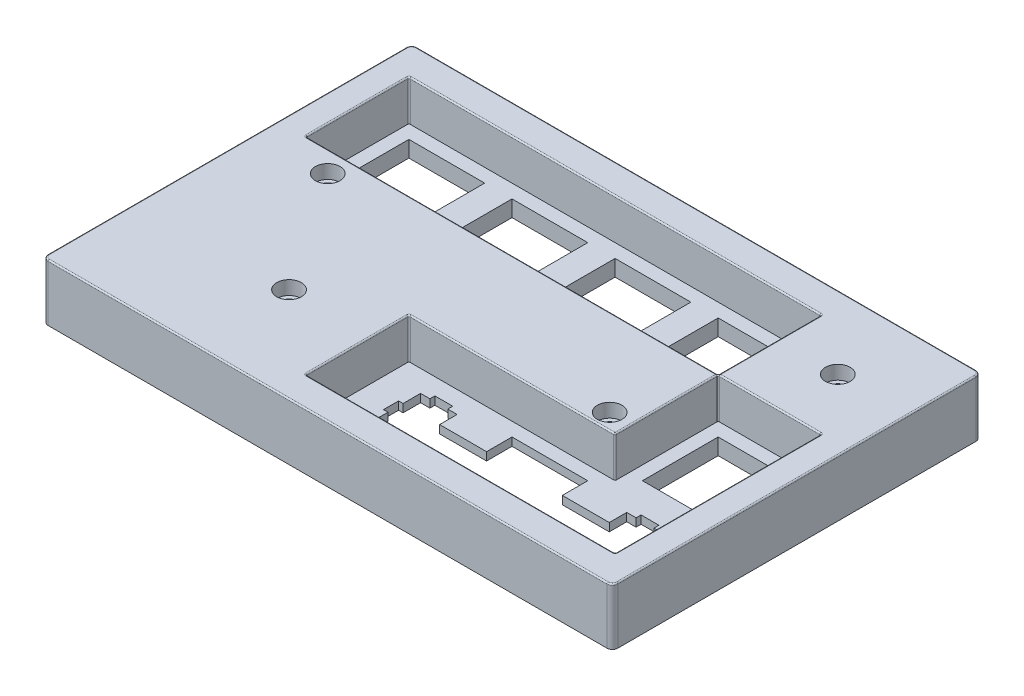
from build123d import *

# Parameters (mm, degrees)
SKETCH5_W           = 105.25
SKETCH5_H           = 68.15
SKETCH5_W_2         = 13.9993
SKETCH5_H_2         = 13.9994
SKETCH5_H_3         = 13.9993
SKETCH5_W_3         = 13.99955
BOSS_EXTRUDE1_DEPTH = 3
SKETCH6_W           = 52.0993
SKETCH6_H           = 19.04996
CUT_EXTRUDE1_DEPTH  = 1.5
SKETCH7_W           = 105.25
SKETCH7_H           = 68.15
SKETCH7_W_2         = 95.24985
SKETCH7_H_2         = 57.14996
BOSS_EXTRUDE2_DEPTH = 7.5
SKETCH9_R           = 1.5
CUT_EXTRUDE3_DEPTH  = 119.670818994
BOSS_EXTRUDE4_START = 7.5
SKETCH10_R          = 1.5
BOSS_EXTRUDE4_DEPTH = 7.5
SKETCH13_R          = 2.275
CUT_EXTRUDE5_DEPTH  = 2.55
FILLET1_R           = 0.25
FILLET2_R           = 1
FILLET3_R           = 0.25


with BuildPart() as part:
    # Sketch5 → Boss-Extrude1 (new body)
    with BuildSketch(Plane(origin=(0, 0, 0), x_dir=(1, 0, 0), z_dir=(0, 1, 0))):
        with Locations((47.7201423, 28.8325965)):
            Rectangle(SKETCH5_W, SKETCH5_H)
        Polygon((82.4438, 7.48273), (82.4438, 3.01377), (84.1692, 3.01377), (84.1692, 2.03261), (87.4695, 2.03261), (87.4695, 3.01377), (89.1949, 3.01377), (89.1949, 9.28384), (90.019, 9.28384), (90.019, 12.0826), (89.1949, 12.0826), (89.1949, 15.3128), (87.4695, 15.3128), (87.4695, 16.2333), (84.1692, 16.2333), (84.1692, 15.3128), (82.4438, 15.3128), (82.4438, 12.0826), (73.769, 12.0826), (73.769, 16.7831), (59.7697, 16.7831), (59.7697, 12.0826), (51.0949, 12.0826), (51.0949, 15.3128), (49.3695, 15.3128), (49.3695, 16.2333), (46.0692, 16.2333), (46.0692, 15.3128), (44.3438, 15.3128), (44.3438, 12.0826), (43.5197, 12.0826), (43.5197, 9.28384), (44.3438, 9.28384), (44.3438, 3.01377), (46.0692, 3.01377), (46.0692, 2.03261), (49.3695, 2.03261), (49.3695, 3.01377), (51.0949, 3.01377), (51.0949, 7.48273), (59.7697, 7.48273), (59.7697, 2.78364), (73.769, 2.78364), (73.769, 7.48273), align=None, mode=Mode.SUBTRACT)
        with Locations((85.81935, 28.8333)):
            Rectangle(SKETCH5_W_2, SKETCH5_H_2, mode=Mode.SUBTRACT)
        with Locations((66.76935, 47.88345)):
            Rectangle(SKETCH5_W_2, SKETCH5_H_3, mode=Mode.SUBTRACT)
        with Locations((47.71935, 47.88345)):
            Rectangle(SKETCH5_W_2, SKETCH5_H_3, mode=Mode.SUBTRACT)
        with Locations((28.66935, 47.88345)):
            Rectangle(SKETCH5_W_2, SKETCH5_H_3, mode=Mode.SUBTRACT)
        with Locations((9.619425, 47.88345)):
            Rectangle(SKETCH5_W_3, SKETCH5_H_3, mode=Mode.SUBTRACT)
    extrude(amount=BOSS_EXTRUDE1_DEPTH)

    # Sketch6 → Cut-Extrude1 (cut)
    with BuildSketch(Plane.XZ):
        with Locations((66.76935, -9.78337)):
            Rectangle(SKETCH6_W, SKETCH6_H)
    extrude(amount=-CUT_EXTRUDE1_DEPTH, mode=Mode.SUBTRACT)

    # Sketch7 → Boss-Extrude2 (add)
    with BuildSketch(Plane(origin=(0, 3, 0), x_dir=(1, 0, 0), z_dir=(0, 1, 0))):
        with Locations((47.7201423, 28.8325965)):
            Rectangle(SKETCH7_W, SKETCH7_H)
        with Locations((47.719325, 28.83337)):
            Rectangle(SKETCH7_W_2, SKETCH7_H_2, mode=Mode.SUBTRACT)
    extrude(amount=BOSS_EXTRUDE2_DEPTH)

    # Sketch9 → Cut-Extrude3 (cut, through all)
    with BuildSketch(Plane(origin=(0, 3, 0), x_dir=(1, 0, 0), z_dir=(0, 1, 0))):
        with Locations(Location((8.094425, 34.40845, 0), (0, 0, 270))):
            Circle(SKETCH9_R)
        with Locations(Location((23.094425, 12.25845, 0), (0, 0, 270))):
            Circle(SKETCH9_R)
        with Locations(Location((87.344425, 49.40845, 0), (0, 0, 270))):
            Circle(SKETCH9_R)
        with Locations(Location((72.344425, 22.25845, 0), (0, 0, 270))):
            Circle(SKETCH9_R)
    extrude(amount=-CUT_EXTRUDE3_DEPTH, mode=Mode.SUBTRACT)

    # Sketch10 → Boss-Extrude4 (add)
    with BuildSketch(Plane(origin=(0, 3, 0), x_dir=(1, 0, 0), z_dir=(0, 1, 0)).offset(BOSS_EXTRUDE4_START)):
        with BuildLine():
            Line((0.0944, 0.25839), (0.0944, 38.35855))
            Line((0.0944, 38.35855), (76.04445, 38.35855))
            ThreePointArc((76.04445, 38.35855), (76.221226695, 38.431773305), (76.29445, 38.60855))
            Line((76.29445, 38.60855), (76.29445, 57.40835))
            Line((76.29445, 57.40835), (95.34425, 57.40835))
            Line((95.34425, 57.40835), (95.34425, 38.35855))
            Line((95.34425, 38.35855), (76.54445, 38.35855))
            ThreePointArc((76.54445, 38.35855), (76.367673305, 38.285326695), (76.29445, 38.10855))
            Line((76.29445, 38.10855), (76.29445, 19.30835))
            Line((76.29445, 19.30835), (38.19435, 19.30835))
            Line((38.19435, 19.30835), (38.19435, 0.25839))
            Line((38.19435, 0.25839), (0.0944, 0.25839))
        make_face()
        with Locations(Location((87.344425, 49.40845, 0), (0, 0, 270))):
            Circle(SKETCH10_R, mode=Mode.SUBTRACT)
        with Locations(Location((72.344425, 22.25845, 0), (0, 0, 270))):
            Circle(SKETCH10_R, mode=Mode.SUBTRACT)
        with Locations(Location((8.094425, 34.40845, 0), (0, 0, 270))):
            Circle(SKETCH10_R, mode=Mode.SUBTRACT)
        with Locations(Location((23.094425, 12.25845, 0), (0, 0, 270))):
            Circle(SKETCH10_R, mode=Mode.SUBTRACT)
    extrude(amount=-BOSS_EXTRUDE4_DEPTH)

    # Sketch13 → Cut-Extrude5 (cut)
    with BuildSketch(Plane(origin=(0, 10.5, 0), x_dir=(1, 0, 0), z_dir=(0, 1, 0))):
        with Locations(Location((8.094425, 34.40845, 0), (0, 0, 270))):
            Circle(SKETCH13_R)
        with Locations(Location((23.094425, 12.25845, 0), (0, 0, 270))):
            Circle(SKETCH13_R)
        with Locations(Location((87.344425, 49.40845, 0), (0, 0, 270))):
            Circle(SKETCH13_R)
        with Locations(Location((72.344425, 22.25845, 0), (0, 0, 270))):
            Circle(SKETCH13_R)
    extrude(amount=-CUT_EXTRUDE5_DEPTH, mode=Mode.SUBTRACT)

    # Fillet1
    fillet1_edges = [part.edges().sort_by_distance(p)[0] for p in [
        (95.34425, 6.75, -0.25839),
        (0.0944, 6.75, -57.40835),
        (76.29445, 6.75, -57.40835),
        (95.34425, 6.75, -38.35855),
        (76.29445, 6.75, -19.30835),
        (38.19435, 6.75, -19.30835),
        (38.19435, 6.75, -0.25839),
        (0.0944, 6.75, -38.35855),
    ]]
    fillet(fillet1_edges, radius=FILLET1_R)

    # Fillet2
    fillet2_edges = [part.edges().sort_by_distance(p)[0] for p in [
        (-4.9048577, 5.25, -62.9075965),
        (100.3451423, 5.25, -62.9075965),
        (100.3451423, 5.25, 5.2424035),
        (-4.9048577, 5.25, 5.2424035),
    ]]
    fillet(fillet2_edges, radius=FILLET2_R)

    # Fillet3
    # the kernel refuses this fillet: 0.25 mm, written as the material it takes off along each edge
    with BuildSketch(Plane(origin=(76.04445, 10.5, -38.60855), x_dir=(0, 0, 1), z_dir=(-1, 0, 0))) as fillet3_piece_1:
        with BuildLine():
            CenterArc((0.25 + FILLET3_R, -FILLET3_R), FILLET3_R, 90, 90)
            Line((0.25, -FILLET3_R), (0.25, 0))
            Line((0.25, 0), (0.25 + FILLET3_R, 0))
        make_face()
    revolve(axis=Axis((76.04445, 10.5, -38.60855), (0, 1, 0)), revolution_arc=90, mode=Mode.SUBTRACT)
    with BuildSketch(Plane(origin=(0.3444, 10.5, -38.35855), x_dir=(0, 0, 1), z_dir=(1, 0, 0))) as fillet3_piece_2:
        with BuildLine():
            CenterArc((FILLET3_R, FILLET3_R), FILLET3_R, 180, 90)
            Line((0, FILLET3_R), (0, 0))
            Line((0, 0), (FILLET3_R, 0))
        make_face()
    extrude(amount=75.70005, mode=Mode.SUBTRACT)
    with BuildSketch(Plane(origin=(76.54445, 10.5, -38.10855), x_dir=(0, 0, -1), z_dir=(1, 0, 0))) as fillet3_piece_3:
        with BuildLine():
            CenterArc((0.25 + FILLET3_R, -FILLET3_R), FILLET3_R, 90, 90)
            Line((0.25, -FILLET3_R), (0.25, 0))
            Line((0.25, 0), (0.25 + FILLET3_R, 0))
        make_face()
    revolve(axis=Axis((76.54445, 10.5, -38.10855), (0, 1, 0)), revolution_arc=90, mode=Mode.SUBTRACT)
    with BuildSketch(Plane(origin=(95.09425, 10.5, -38.35855), x_dir=(0, 0, -1), z_dir=(-1, 0, 0)), Plane(origin=(76.29445, 10.5, -38.60855), x_dir=(1, 0, 0), z_dir=(0, 0, -1))) as fillet3_piece_4:
        with BuildLine():
            CenterArc((FILLET3_R, FILLET3_R), FILLET3_R, 180, 90)
            Line((0, FILLET3_R), (0, 0))
            Line((0, 0), (FILLET3_R, 0))
        make_face()
    extrude(amount=18.5498, mode=Mode.SUBTRACT)
    with BuildSketch(Plane(origin=(95.09425, 10.5, -0.25839), x_dir=(0, 0, 1), z_dir=(-1, 0, 0))) as fillet3_piece_5:
        with BuildLine():
            CenterArc((FILLET3_R, -FILLET3_R), FILLET3_R, 90, 90)
            Line((0, -FILLET3_R), (0, 0))
            Line((0, 0), (FILLET3_R, 0))
        make_face()
    extrude(amount=56.6499, mode=Mode.SUBTRACT)
    with BuildSketch(Plane(origin=(95.34425, 10.5, -38.10855), x_dir=(1, 0, 0), z_dir=(0, 0, 1))) as fillet3_piece_6:
        with BuildLine():
            CenterArc((FILLET3_R, -FILLET3_R), FILLET3_R, 90, 90)
            Line((0, -FILLET3_R), (0, 0))
            Line((0, 0), (FILLET3_R, 0))
        make_face()
    extrude(amount=37.60016, mode=Mode.SUBTRACT)
    with BuildSketch(Plane(origin=(38.19435, 10.5, -19.05835), x_dir=(-1, 0, 0), z_dir=(0, 0, 1))) as fillet3_piece_7:
        with BuildLine():
            CenterArc((FILLET3_R, FILLET3_R), FILLET3_R, 180, 90)
            Line((0, FILLET3_R), (0, 0))
            Line((0, 0), (FILLET3_R, 0))
        make_face()
    extrude(amount=18.54996, mode=Mode.SUBTRACT)
    with BuildSketch(Plane(origin=(76.04445, 10.5, -19.30835), x_dir=(0, 0, -1), z_dir=(-1, 0, 0))) as fillet3_piece_8:
        with BuildLine():
            CenterArc((FILLET3_R, FILLET3_R), FILLET3_R, 180, 90)
            Line((0, FILLET3_R), (0, 0))
            Line((0, 0), (FILLET3_R, 0))
        make_face()
    extrude(amount=37.6001, mode=Mode.SUBTRACT)
    with BuildSketch(Plane(origin=(76.29445, 10.5, -38.10855), x_dir=(-1, 0, 0), z_dir=(0, 0, 1))) as fillet3_piece_9:
        with BuildLine():
            CenterArc((FILLET3_R, FILLET3_R), FILLET3_R, 180, 90)
            Line((0, FILLET3_R), (0, 0))
            Line((0, 0), (FILLET3_R, 0))
        make_face()
    extrude(amount=18.5502, mode=Mode.SUBTRACT)
    with BuildSketch(Plane(origin=(0.0944, 10.5, -38.60855), x_dir=(-1, 0, 0), z_dir=(0, 0, -1))) as fillet3_piece_10:
        with BuildLine():
            CenterArc((FILLET3_R, -FILLET3_R), FILLET3_R, 90, 90)
            Line((0, -FILLET3_R), (0, 0))
            Line((0, 0), (FILLET3_R, 0))
        make_face()
    extrude(amount=18.5498, mode=Mode.SUBTRACT)
    with BuildSketch(Plane(origin=(0.3444, 10.5, -57.40835), x_dir=(0, 0, -1), z_dir=(1, 0, 0))) as fillet3_piece_11:
        with BuildLine():
            CenterArc((FILLET3_R, -FILLET3_R), FILLET3_R, 90, 90)
            Line((0, -FILLET3_R), (0, 0))
            Line((0, 0), (FILLET3_R, 0))
        make_face()
    extrude(amount=75.70005, mode=Mode.SUBTRACT)
    with BuildSketch(Plane(origin=(76.04445, 10.5, -19.55835), x_dir=(1, 0, 0), z_dir=(0, 0, -1))) as fillet3_piece_12:
        with BuildLine():
            CenterArc((0.25 - FILLET3_R, FILLET3_R), FILLET3_R, 270, 90)
            Line((0.25, FILLET3_R), (0.25, 0))
            Line((0.25, 0), (0.25 - FILLET3_R, 0))
        make_face()
    revolve(axis=Axis((76.04445, 10.5, -19.55835), (0, -1, 0)), revolution_arc=90, mode=Mode.SUBTRACT)
    with BuildSketch(Plane(origin=(95.09425, 10.5, -0.50839), x_dir=(1, 0, 0), z_dir=(0, 0, -1))) as fillet3_piece_13:
        with BuildLine():
            CenterArc((0.25 + FILLET3_R, FILLET3_R), FILLET3_R, 180, 90)
            Line((0.25, FILLET3_R), (0.25, 0))
            Line((0.25, 0), (0.25 + FILLET3_R, 0))
        make_face()
    revolve(axis=Axis((95.09425, 10.5, -0.50839), (0, -1, 0)), revolution_arc=90, mode=Mode.SUBTRACT)
    with BuildSketch(Plane(origin=(38.44435, 10.5, -0.50839), x_dir=(0, 0, 1), z_dir=(1, 0, 0))) as fillet3_piece_14:
        with BuildLine():
            CenterArc((0.25 + FILLET3_R, FILLET3_R), FILLET3_R, 180, 90)
            Line((0.25, FILLET3_R), (0.25, 0))
            Line((0.25, 0), (0.25 + FILLET3_R, 0))
        make_face()
    revolve(axis=Axis((38.44435, 10.5, -0.50839), (0, -1, 0)), revolution_arc=90, mode=Mode.SUBTRACT)
    with BuildSketch(Plane(origin=(38.44435, 10.5, -19.05835), x_dir=(-1, 0, 0), z_dir=(0, 0, 1))) as fillet3_piece_15:
        with BuildLine():
            CenterArc((0.25 + FILLET3_R, FILLET3_R), FILLET3_R, 180, 90)
            Line((0.25, FILLET3_R), (0.25, 0))
            Line((0.25, 0), (0.25 + FILLET3_R, 0))
        make_face()
    revolve(axis=Axis((38.44435, 10.5, -19.05835), (0, -1, 0)), revolution_arc=90, mode=Mode.SUBTRACT)
    with BuildSketch(Plane(origin=(95.09425, 10.5, -38.10855), x_dir=(1, 0, 0), z_dir=(0, 0, 1))) as fillet3_piece_16:
        with BuildLine():
            CenterArc((0.25 + FILLET3_R, -FILLET3_R), FILLET3_R, 90, 90)
            Line((0.25, -FILLET3_R), (0.25, 0))
            Line((0.25, 0), (0.25 + FILLET3_R, 0))
        make_face()
    revolve(axis=Axis((95.09425, 10.5, -38.10855), (0, 1, 0)), revolution_arc=90, mode=Mode.SUBTRACT)
    with BuildSketch(Plane(origin=(76.04445, 10.5, -57.15835), x_dir=(0, 0, -1), z_dir=(-1, 0, 0))) as fillet3_piece_17:
        with BuildLine():
            CenterArc((0.25 + FILLET3_R, FILLET3_R), FILLET3_R, 180, 90)
            Line((0.25, FILLET3_R), (0.25, 0))
            Line((0.25, 0), (0.25 + FILLET3_R, 0))
        make_face()
    revolve(axis=Axis((76.04445, 10.5, -57.15835), (0, -1, 0)), revolution_arc=90, mode=Mode.SUBTRACT)
    with BuildSketch(Plane(origin=(0.3444, 10.5, -38.60855), x_dir=(-1, 0, 0), z_dir=(0, 0, -1))) as fillet3_piece_18:
        with BuildLine():
            CenterArc((0.25 + FILLET3_R, -FILLET3_R), FILLET3_R, 90, 90)
            Line((0.25, -FILLET3_R), (0.25, 0))
            Line((0.25, 0), (0.25 + FILLET3_R, 0))
        make_face()
    revolve(axis=Axis((0.3444, 10.5, -38.60855), (0, 1, 0)), revolution_arc=90, mode=Mode.SUBTRACT)
    with BuildSketch(Plane(origin=(0.3444, 10.5, -57.15835), x_dir=(0, 0, -1), z_dir=(1, 0, 0))) as fillet3_piece_19:
        with BuildLine():
            CenterArc((0.25 + FILLET3_R, -FILLET3_R), FILLET3_R, 90, 90)
            Line((0.25, -FILLET3_R), (0.25, 0))
            Line((0.25, 0), (0.25 + FILLET3_R, 0))
        make_face()
    revolve(axis=Axis((0.3444, 10.5, -57.15835), (0, 1, 0)), revolution_arc=90, mode=Mode.SUBTRACT)
    with BuildSketch(Plane(origin=(99.3451423, 10.5, -62.9075965), x_dir=(0, 0, 1), z_dir=(-1, 0, 0)), Plane(origin=(-3.9048577, 10.5, 5.2424035), x_dir=(0, 0, -1), z_dir=(1, 0, 0))) as fillet3_piece_20:
        with BuildLine():
            CenterArc((FILLET3_R, -FILLET3_R), FILLET3_R, 90, 90)
            Line((0, -FILLET3_R), (0, 0))
            Line((0, 0), (FILLET3_R, 0))
        make_face()
    extrude(amount=103.25, mode=Mode.SUBTRACT)
    with BuildSketch(Plane(origin=(100.3451423, 10.5, 4.2424035), x_dir=(-1, 0, 0), z_dir=(0, 0, -1)), Plane(origin=(-4.9048577, 10.5, -61.9075965), x_dir=(1, 0, 0), z_dir=(0, 0, 1))) as fillet3_piece_21:
        with BuildLine():
            CenterArc((FILLET3_R, -FILLET3_R), FILLET3_R, 90, 90)
            Line((0, -FILLET3_R), (0, 0))
            Line((0, 0), (FILLET3_R, 0))
        make_face()
    extrude(amount=66.15, mode=Mode.SUBTRACT)
    with BuildSketch(Plane(origin=(-3.9048577, 10.5, -61.9075965), x_dir=(0, 0, -1), z_dir=(1, 0, 0))) as fillet3_piece_22:
        with BuildLine():
            CenterArc((1 - FILLET3_R, -FILLET3_R), FILLET3_R, 0, 90)
            Line((1, -FILLET3_R), (1, 0))
            Line((1, 0), (1 - FILLET3_R, 0))
        make_face()
    revolve(axis=Axis((-3.9048577, 10.5, -61.9075965), (0, 1, 0)), revolution_arc=90, mode=Mode.SUBTRACT)
    with BuildSketch(Plane(origin=(-3.9048577, 10.5, 4.2424035), x_dir=(0, 0, 1), z_dir=(1, 0, 0))) as fillet3_piece_23:
        with BuildLine():
            CenterArc((1 - FILLET3_R, FILLET3_R), FILLET3_R, 270, 90)
            Line((1, FILLET3_R), (1, 0))
            Line((1, 0), (1 - FILLET3_R, 0))
        make_face()
    revolve(axis=Axis((-3.9048577, 10.5, 4.2424035), (0, -1, 0)), revolution_arc=90, mode=Mode.SUBTRACT)
    with BuildSketch(Plane(origin=(99.3451423, 10.5, 4.2424035), x_dir=(1, 0, 0), z_dir=(0, 0, -1))) as fillet3_piece_24:
        with BuildLine():
            CenterArc((1 - FILLET3_R, FILLET3_R), FILLET3_R, 270, 90)
            Line((1, FILLET3_R), (1, 0))
            Line((1, 0), (1 - FILLET3_R, 0))
        make_face()
    revolve(axis=Axis((99.3451423, 10.5, 4.2424035), (0, -1, 0)), revolution_arc=90, mode=Mode.SUBTRACT)
    with BuildSketch(Plane(origin=(99.3451423, 10.5, -61.9075965), x_dir=(1, 0, 0), z_dir=(0, 0, 1))) as fillet3_piece_25:
        with BuildLine():
            CenterArc((1 - FILLET3_R, -FILLET3_R), FILLET3_R, 0, 90)
            Line((1, -FILLET3_R), (1, 0))
            Line((1, 0), (1 - FILLET3_R, 0))
        make_face()
    revolve(axis=Axis((99.3451423, 10.5, -61.9075965), (0, 1, 0)), revolution_arc=90, mode=Mode.SUBTRACT)


solid = part.part
